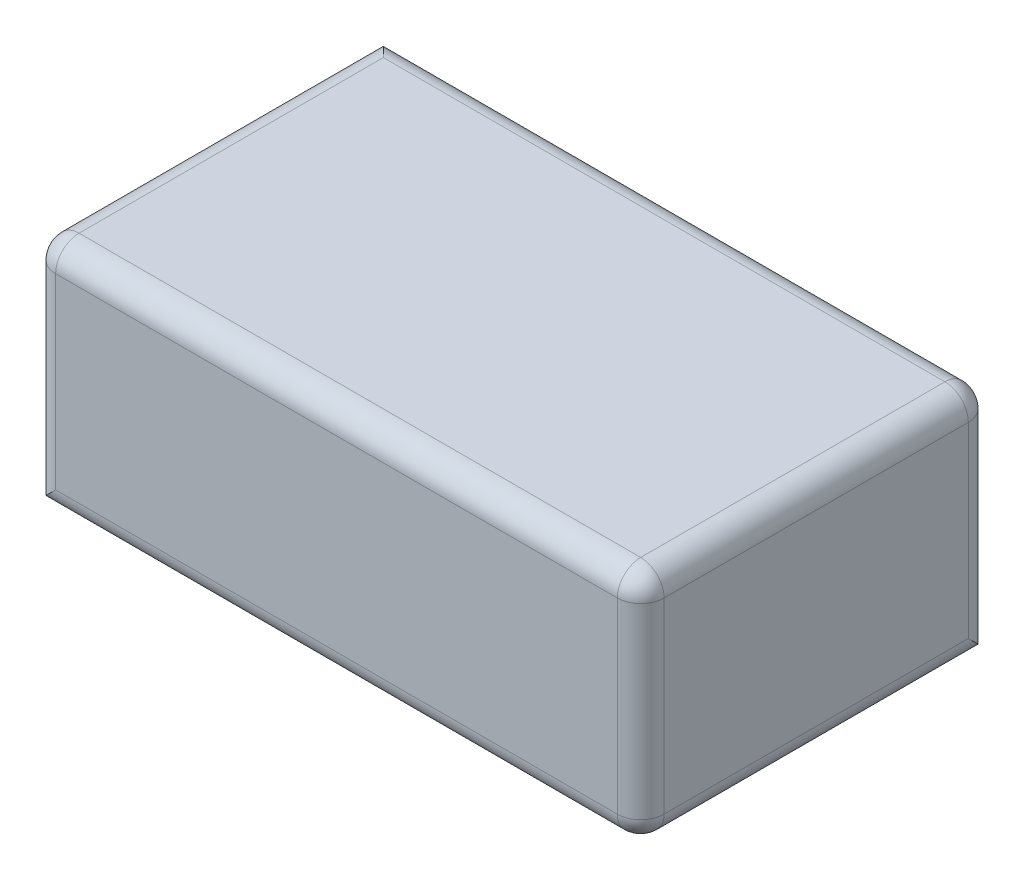
from build123d import *

# Parameters (mm, degrees)
SKETCH1_W           = 52
SKETCH1_H           = 30
BOSS_EXTRUDE1_DEPTH = 20
FILLET1_R           = 2


with BuildPart() as part:
    # Sketch1 → Boss-Extrude1 (new body)
    with BuildSketch(Plane(origin=(0, 0, 0), x_dir=(1, 0, 0), z_dir=(0, 1, 0))):
        Rectangle(SKETCH1_W, SKETCH1_H)
    extrude(amount=BOSS_EXTRUDE1_DEPTH)

    # Fillet1
    fillet1_edges = [part.edges().sort_by_distance(p)[0] for p in [
        (26, 0, 0),
        (0, 0, 15),
        (26, 20, 0),
        (0, 20, -15),
        (-26, 20, 0),
        (0, 20, 15),
        (26, 10, 15),
        (-26, 10, 15),
        (26, 10, -15),
    ]]
    fillet(fillet1_edges, radius=FILLET1_R)


solid = part.part
